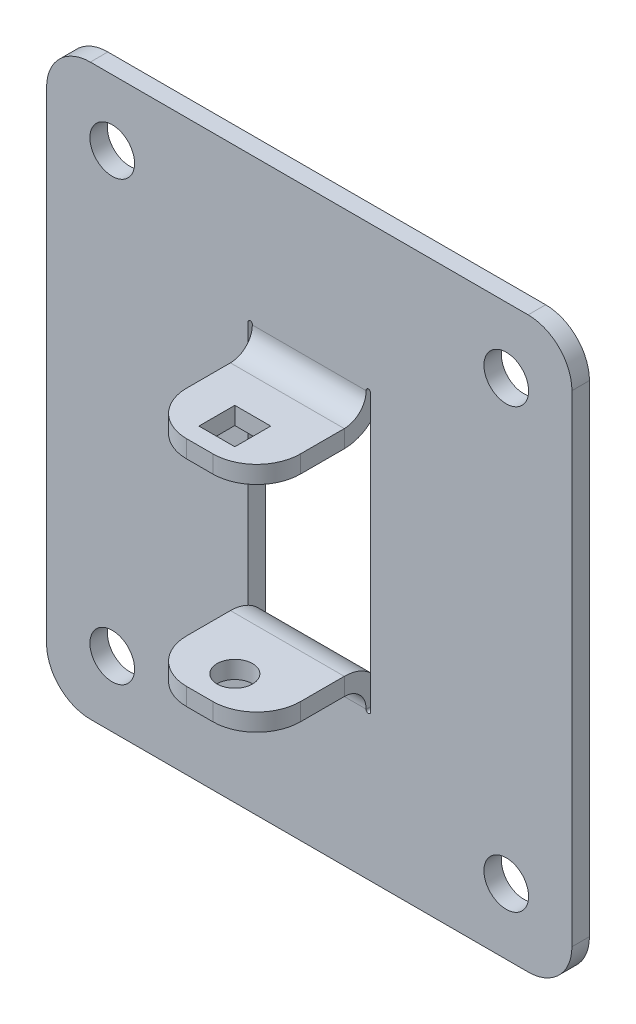
from build123d import *

# Parameters (mm, degrees)
SKETCH_1_W                   = 120
SKETCH_1_H                   = 130
SKETCH_1_W_2                 = 28
SKETCH_1_H_2                 = 45
SM_BASE_FLANGE_1_DEPTH       = 4
SM_START                     = -4
SM_EDGE_FLANGE_1_DEPTH       = 4
SM_EDGE_FLANGE_1_2_OUTLINE_W = 26
SM_EDGE_FLANGE_1_2_OUTLINE_H = 4
SM_EDGE_FLANGE_1_2_DEPTH     = 0.41096
SM_START_2                   = 5
SM_EDGE_FLANGE_1_3_OUTLINE_W = 26
SM_EDGE_FLANGE_1_3_OUTLINE_H = 4
SM_EDGE_FLANGE_1_3_DEPTH     = 20
SM_START_3                   = -13
SM_EDGE_FLANGE_1_4_DEPTH     = 26
SM_EDGE_FLANGE_1_5_DEPTH     = 26
CUT_EXTRUDE_1_DEPTH          = 92.923881554
CUT_EXTRUDE_1_DEPTH_BACK     = 92.923881554
SKETCH_10_R                  = 4.05
SKETCH_12_W                  = 8.2
SKETCH_12_H                  = 8.2
CUT_EXTRUDE_3_DEPTH          = 4
FILLET_1_R                   = 10
SKETCH_11_R                  = 5.1
CUT_EXTRUDE_2_DEPTH          = 4


with BuildPart() as part:
    # Базовая кромка1: sheet metal written as solids
    # Sketch 1 → Базовая кромка1 (new body)
    with BuildSketch(Plane.XY):
        Rectangle(SKETCH_1_W, SKETCH_1_H)
        Rectangle(SKETCH_1_W_2, SKETCH_1_H_2, mode=Mode.SUBTRACT)
    extrude(amount=-SM_BASE_FLANGE_1_DEPTH)

    # Ребро-кромка1: read off the stored shape, not the designer's step
    # Ребро-кромка1 outline → Ребро-кромка1 (cut)
    with BuildSketch(Plane.XY.offset(SM_START)):
        with BuildLine():
            ThreePointArc((-13, 31.6), (-13.5, 32.1), (-14, 31.6))
            Line((-14, 31.6), (-14, 22.5))
            Line((-14, 22.5), (-13, 22.5))
            Line((-13, 22.5), (-13, 31.6))
        make_face()
        with BuildLine():
            Line((-13, -22.5), (-14, -22.5))
            Line((-14, -22.5), (-14, -31.6))
            ThreePointArc((-14, -31.6), (-13.5, -32.1), (-13, -31.6))
            Line((-13, -31.6), (-13, -22.5))
        make_face()
        with BuildLine():
            Line((13, 31.6), (13, 22.5))
            Line((13, 22.5), (14, 22.5))
            Line((14, 22.5), (14, 31.6))
            ThreePointArc((14, 31.6), (13.5, 32.1), (13, 31.6))
        make_face()
        with BuildLine():
            Line((14, -22.5), (13, -22.5))
            Line((13, -22.5), (13, -31.6))
            ThreePointArc((13, -31.6), (13.5, -32.1), (14, -31.6))
            Line((14, -31.6), (14, -22.5))
        make_face()
    extrude(amount=SM_EDGE_FLANGE_1_DEPTH, mode=Mode.SUBTRACT)

    # Sm Edge Flange 1 2 outline → Sm Edge Flange 1 2 (cut)
    with BuildSketch(Plane.XY.offset(SM_START)):
        with Locations((0, 24.5)):
            Rectangle(SM_EDGE_FLANGE_1_2_OUTLINE_W, SM_EDGE_FLANGE_1_2_OUTLINE_H)
        with Locations((0, -24.5)):
            Rectangle(SM_EDGE_FLANGE_1_2_OUTLINE_W, SM_EDGE_FLANGE_1_2_OUTLINE_H)
    extrude(amount=SM_EDGE_FLANGE_1_2_DEPTH, mode=Mode.SUBTRACT)

    # Sm Edge Flange 1 4 outline → Sm Edge Flange 1 4 (cut)
    with BuildSketch(Plane.YZ.offset(SM_START_3)):
        with BuildLine():
            ThreePointArc((31.5, -4), (27.257359313, -2.937253933), (24.016685226, 0))
            Line((24.016685226, 0), (22.5, 0))
            Line((22.5, 0), (22.5, -3.58904))
            Line((22.5, -3.58904), (26.5, -3.58904))
            Line((26.5, -3.58904), (26.5, -4))
            Line((26.5, -4), (31.5, -4))
        make_face()
        with BuildLine():
            Line((-22.5, -3.58904), (-22.5, 0))
            Line((-22.5, 0), (-24.016685226, 0))
            ThreePointArc((-24.016685226, 0), (-27.257359313, -2.937253933), (-31.5, -4))
            Line((-31.5, -4), (-26.5, -4))
            Line((-26.5, -4), (-26.5, -3.58904))
            Line((-26.5, -3.58904), (-22.5, -3.58904))
        make_face()
    extrude(amount=SM_EDGE_FLANGE_1_4_DEPTH, mode=Mode.SUBTRACT)



with BuildPart() as body_2:
    # Sm Edge Flange 1 3 outline → Sm Edge Flange 1 3 (new body)
    with BuildSketch(Plane.XY.offset(SM_START_2)):
        with Locations((0, 24.5)):
            Rectangle(SM_EDGE_FLANGE_1_3_OUTLINE_W, SM_EDGE_FLANGE_1_3_OUTLINE_H)
        with Locations((0, -24.5)):
            Rectangle(SM_EDGE_FLANGE_1_3_OUTLINE_W, SM_EDGE_FLANGE_1_3_OUTLINE_H)
    extrude(amount=SM_EDGE_FLANGE_1_3_DEPTH)


with BuildPart() as part_1:
    add(part.part)

    add(body_2.part)  # Sm Edge Flange 1 5 merges body 2
    # Sm Edge Flange 1 5 outline → Sm Edge Flange 1 5 (add)
    with BuildSketch(Plane.YZ.offset(SM_START_3)):
        with BuildLine():
            Line((26.5, 5), (22.5, 5))
            ThreePointArc((22.5, 5), (22.88751392, 2.38751392), (24.016685226, 0))
            Line((24.016685226, 0), (31.5, 0))
            ThreePointArc((31.5, 0), (27.964466094, 1.464466094), (26.5, 5))
        make_face()
        with BuildLine():
            Line((-31.5, 0), (-24.016685226, 0))
            ThreePointArc((-24.016685226, 0), (-22.88751392, 2.38751392), (-22.5, 5))
            Line((-22.5, 5), (-26.5, 5))
            ThreePointArc((-26.5, 5), (-27.964466094, 1.464466094), (-31.5, 0))
        make_face()
    extrude(amount=SM_EDGE_FLANGE_1_5_DEPTH)

    # Эскиз10 → Вырез-Вытянуть1 (cut, two sides: drawn at the far end of the back side and taken through both)
    with BuildSketch(Plane(origin=(0, 0, 0), x_dir=(1, 0, 0), z_dir=(0, 1, 0)).offset(-CUT_EXTRUDE_1_DEPTH_BACK)):
        with Locations(Location((0, -17, 0), (0, 0, 90))):
            Circle(SKETCH_10_R)
    extrude(amount=CUT_EXTRUDE_1_DEPTH + CUT_EXTRUDE_1_DEPTH_BACK, mode=Mode.SUBTRACT)

    # Эскиз12 → Вырез-Вытянуть3 (cut)
    with BuildSketch(Plane(origin=(0, 26.5, 0), x_dir=(1, 0, 0), z_dir=(0, 1, 0))):
        with Locations((0, -17)):
            Rectangle(SKETCH_12_W, SKETCH_12_H)
    extrude(amount=-CUT_EXTRUDE_3_DEPTH, mode=Mode.SUBTRACT)

    # Скругление1
    fillet_1_edges = [part_1.edges().sort_by_distance(p)[0] for p in [
        (13, -24.5, 25),
        (-13, -24.5, 25),
        (-60, 65, -2),
        (60, 65, -2),
        (60, -65, -2),
        (-60, -65, -2),
        (-13, 24.5, 25),
        (13, 24.5, 25),
    ]]
    fillet(fillet_1_edges, radius=FILLET_1_R)

    # Эскиз11 → Вырез-Вытянуть2 (cut)
    with BuildSketch(Plane.XY):
        with Locations((-45, 50)):
            Circle(SKETCH_11_R)
        with Locations((45, 50)):
            Circle(SKETCH_11_R)
        with Locations((-45, -50)):
            Circle(SKETCH_11_R)
        with Locations((45, -50)):
            Circle(SKETCH_11_R)
    extrude(amount=-CUT_EXTRUDE_2_DEPTH, mode=Mode.SUBTRACT)


solid = part_1.part
